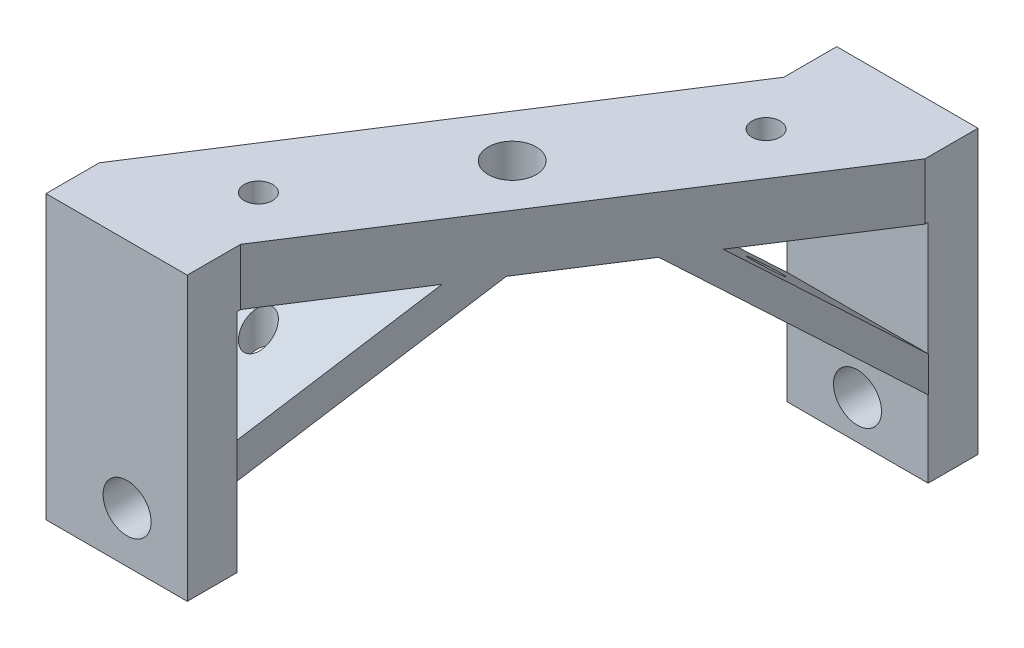
from build123d import *
from build123d.topology import SkipClean

# Parameters (mm, degrees)
SCHIZZO9_W                          = 10
SCHIZZO9_H                          = 20
ESTRUSIONE_ESTRUSIONE5_DEPTH        = 35.05
SCHIZZO10_W                         = 35.05
SCHIZZO10_H                         = 16
TAGLIO_ESTRUSIONE1_DEPTH            = 43.05
SCHIZZO11_R                         = 1.7
TAGLIO_ESTRUSIONE2_DEPTH            = 43.05
SCHIZZO16_W                         = 10
SCHIZZO16_H                         = 4
ESTRUSIONE_ESTRUSIONE8_DEPTH        = 4
SCHIZZO17_W                         = 10
SCHIZZO17_H                         = 4
ESTRUSIONE_ESTRUSIONE9_DEPTH        = 4
ESTRUSIONE_ESTRUSIONE10_OUTLINE_W   = 10
ESTRUSIONE_ESTRUSIONE10_OUTLINE_H   = 3.78
ESTRUSIONE_ESTRUSIONE10_OUTLINE_H_2 = 3.75
ESTRUSIONE_ESTRUSIONE10_DEPTH       = 16
ESTRUSIONE_ESTRUSIONE11_DEPTH       = 10.000000119
ESTRUSIONE_ESTRUSIONE12_DEPTH       = 10.000000119
SCHIZZO21_R                         = 1.7
TAGLIO_ESTRUSIONE5_DEPTH            = 4
TAGLIO_ESTRUSIONE7_DEPTH            = 49.638074625
TAGLIO_ESTRUSIONE7_DEPTH_BACK       = 49.638074625
SCHIZZO23_R                         = 1
TAGLIO_ESTRUSIONE8_DEPTH            = 49.638074625
TAGLIO_ESTRUSIONE8_DEPTH_BACK       = 49.638074625
SCHIZZO24_W                         = 10
SCHIZZO24_H                         = 0.25
SCHIZZO24_H_2                       = 0.22
SCHIZZO25_R                         = 1.7
TAGLIO_ESTRUSIONE9_DEPTH            = 10


# Read off the part's stored shape, not the designer's step: Estrusione-Estrusione10
with BuildPart() as part:
    # Schizzo9 → Estrusione-Estrusione5 (new, along a direction that is not the sketch's normal)
    with BuildSketch(Plane.XY):
        with Locations((5, -10)):
            Rectangle(SCHIZZO9_W, SCHIZZO9_H)
    extrude(amount=-ESTRUSIONE_ESTRUSIONE5_DEPTH, dir=(-0.5415393694615634, 0, 0.8406753899830615))

    # Schizzo10 → Taglio-Estrusione1 (cut, along a direction that is not the sketch's normal)
    with BuildSketch(Plane(origin=(7.067351113, 0, 4.552588206), x_dir=(0.5415393694615636, 0, -0.8406753899830613), z_dir=(0.8406753899830615, 0, 0.5415393694615636))):
        with Locations((22.940393695, -12)):
            Rectangle(SCHIZZO10_W, SCHIZZO10_H)
    extrude(amount=-TAGLIO_ESTRUSIONE1_DEPTH, dir=(1, 0, 0), mode=Mode.SUBTRACT)

    # Schizzo11 → Taglio-Estrusione2 (cut)
    with BuildSketch(Plane(origin=(0, 0, 0), x_dir=(1, 0, 0), z_dir=(0, 1, 0))):
        with Locations(Location((14.49047745, 14.732836209, 0), (0, 0, 270))):
            Circle(SCHIZZO11_R)
    extrude(amount=-TAGLIO_ESTRUSIONE2_DEPTH, mode=Mode.SUBTRACT)

    # Schizzo16 → Estrusione-Estrusione8 (add)
    with BuildSketch(Plane(origin=(0, 0, -29.465672419), x_dir=(-1, 0, 0), z_dir=(0, 0, -1))):
        with Locations((-23.9809549, -2)):
            Rectangle(SCHIZZO16_W, SCHIZZO16_H)
    extrude(amount=ESTRUSIONE_ESTRUSIONE8_DEPTH)

    # Schizzo17 → Estrusione-Estrusione9 (add)
    with BuildSketch(Plane.XY):
        with Locations((5, -2)):
            Rectangle(SCHIZZO17_W, SCHIZZO17_H)
    extrude(amount=ESTRUSIONE_ESTRUSIONE9_DEPTH)

    # Estrusione-Estrusione10 outline → Estrusione-Estrusione10 (add)
    with BuildSketch(Plane.XZ.offset(4)):
        with Locations((23.9809549, -31.575672419)):
            Rectangle(ESTRUSIONE_ESTRUSIONE10_OUTLINE_W, ESTRUSIONE_ESTRUSIONE10_OUTLINE_H)
        with Locations((5, 2.125)):
            Rectangle(ESTRUSIONE_ESTRUSIONE10_OUTLINE_W, ESTRUSIONE_ESTRUSIONE10_OUTLINE_H_2)
    extrude(amount=ESTRUSIONE_ESTRUSIONE10_DEPTH)

    # Schizzo19 → Estrusione-Estrusione11 (add, along a direction that is not the sketch's normal)
    with BuildSketch(Plane(origin=(0, 0, 0), x_dir=(-0.5415393694615636, 0, 0.8406753899830613), z_dir=(-0.8406753899830615, 0, -0.5415393694615636))):
        Polygon((-35.234948586, -12), (-24.717369686, -4), (-21.413778213, -4), (-35.234948586, -14.512815167), align=None)
    extrude(amount=-ESTRUSIONE_ESTRUSIONE11_DEPTH, dir=(-1, 0, 0))

    # Schizzo20 → Estrusione-Estrusione12 (add, along a direction that is not the sketch's normal)
    with SkipClean():  # the faces are left unmerged after this step: merging them gives an invalid solid
        with BuildSketch(Plane(origin=(0, 0, 0), x_dir=(-0.5415393694615636, 0, 0.8406753899830613), z_dir=(-0.8406753899830615, 0, -0.5415393694615636))):
            Polygon((0.210168847, -12), (-10.307410052, -4), (-13.611001525, -4), (0.210168847, -14.512815167), align=None)
        extrude(amount=-ESTRUSIONE_ESTRUSIONE12_DEPTH, dir=(-1, 0, 0))

    # Schizzo21 → Taglio-Estrusione5 (cut)
    with SkipClean():  # the faces are left unmerged after this step: merging them gives an invalid solid
        with BuildSketch(Plane.XY.offset(-29.685672419)):
            with Locations((23.9809549, -17.25)):
                Circle(SCHIZZO21_R)
        extrude(amount=-TAGLIO_ESTRUSIONE5_DEPTH, mode=Mode.SUBTRACT)

    # Schizzo23 → Taglio-Estrusione7 (cut, two sides: drawn at the far end of the back side and taken through both)
    with SkipClean():  # the faces are left unmerged after this step: merging them gives an invalid solid
        with BuildSketch(Plane(origin=(0, 0, 0), x_dir=(1, 0, 0), z_dir=(0, 1, 0)).offset(-TAGLIO_ESTRUSIONE7_DEPTH_BACK)):
            with Locations(Location((7.453304803, 3.802227757, 0), (0, 0, 90))):
                Circle(SCHIZZO23_R)
            with Locations(Location((21.533327934, 25.659787159, 0), (0, 0, 270))):
                Circle(SCHIZZO23_R)
        extrude(amount=TAGLIO_ESTRUSIONE7_DEPTH + TAGLIO_ESTRUSIONE7_DEPTH_BACK, mode=Mode.SUBTRACT)

    # Schizzo24 → Taglio-Estrusione8 (cut, two sides: drawn at the far end of the back side and taken through both)
    with SkipClean():  # the faces are left unmerged after this step: merging them gives an invalid solid
        with BuildSketch(Plane(origin=(0, 0, 0), x_dir=(1, 0, 0), z_dir=(0, 1, 0)).offset(-TAGLIO_ESTRUSIONE8_DEPTH_BACK)):
            with Locations((23.9809549, 33.340672419)):
                Rectangle(SCHIZZO24_W, SCHIZZO24_H)
            with Locations((5, -3.89)):
                Rectangle(SCHIZZO24_W, SCHIZZO24_H_2)
        extrude(amount=TAGLIO_ESTRUSIONE8_DEPTH + TAGLIO_ESTRUSIONE8_DEPTH_BACK, mode=Mode.SUBTRACT)

    # Schizzo25 → Taglio-Estrusione9 (cut)
    with SkipClean():  # the faces are left unmerged after this step: merging them gives an invalid solid
        with BuildSketch(Plane.XY.offset(3.78)):
            with Locations((5.741708588, -16.417479931)):
                Circle(SCHIZZO25_R)
        extrude(amount=-TAGLIO_ESTRUSIONE9_DEPTH, mode=Mode.SUBTRACT)


solid = part.part
